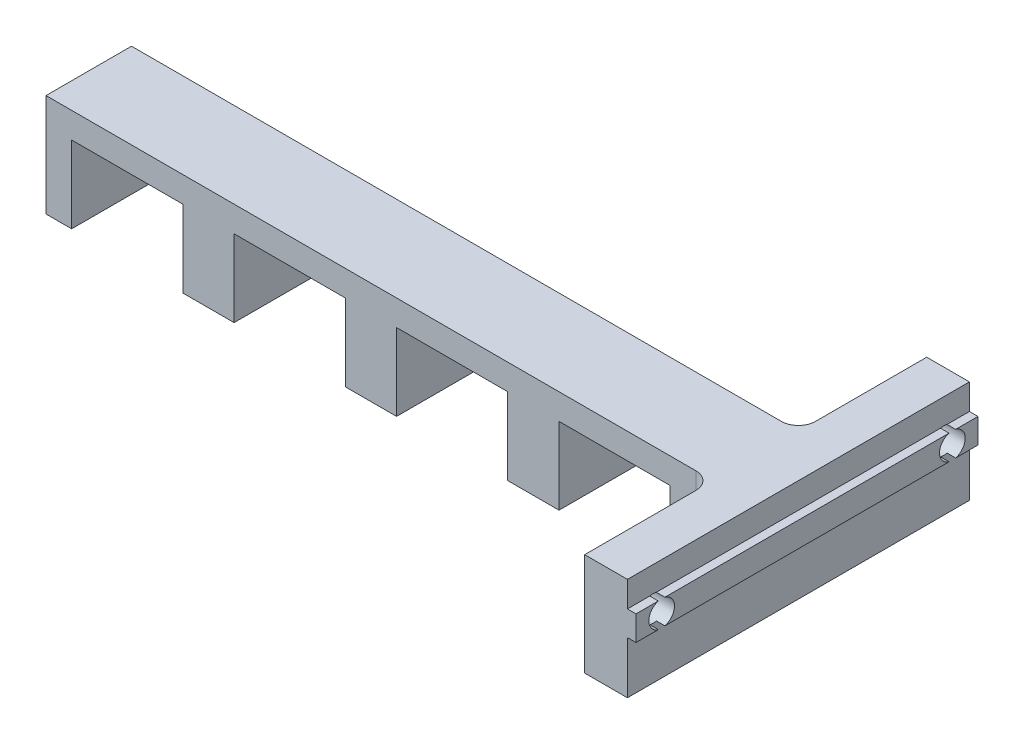
from build123d import *

# Parameters (mm, degrees)
MAIN_DEPTH             = 5
MAKERBEAMFIX_DEPTH     = 20
SKETCH2_R              = 1.5
MAKERBEAMFIXHOLE_DEPTH = 30
FILLET1_R              = 2


with BuildPart() as part:
    # Esquisse1 → Main (new, symmetric)
    with BuildSketch(Plane.XY):
        Polygon((3, 0), (3, 9), (16, 9), (16, 0), (22, 0), (22, 9), (35, 9), (35, 0), (41, 0), (41, 9), (54, 9), (54, 0), (60, 0), (60, 9), (73, 9), (73, 0), (83, 0), (83, 12), (0, 12), (0, 0), align=None)
    extrude(amount=MAIN_DEPTH, both=True)

    # Sketch1 → MakerBeamFix (add, symmetric)
    with BuildSketch(Plane.XY):
        Polygon((78, 12), (83, 12), (83, 9), (84, 9), (84, 6.1), (83, 6.1), (83, 0), (78, 0), align=None)
    extrude(amount=MAKERBEAMFIX_DEPTH, both=True)

    # Sketch2 → MakerBeamFixHole (cut)
    with BuildSketch(Plane(origin=(84, 0, 0), x_dir=(0, 0, -1), z_dir=(1, 0, 0))):
        with Locations((-17, 7.55)):
            Circle(SKETCH2_R)
        with Locations((17, 7.55)):
            Circle(SKETCH2_R)
    extrude(amount=-MAKERBEAMFIXHOLE_DEPTH, mode=Mode.SUBTRACT)

    # Fillet1
    fillet1_edges = [part.edges().sort_by_distance(p)[0] for p in [
        (78, 6, -5),
        (78, 6, 5),
    ]]
    fillet(fillet1_edges, radius=FILLET1_R)


solid = part.part
